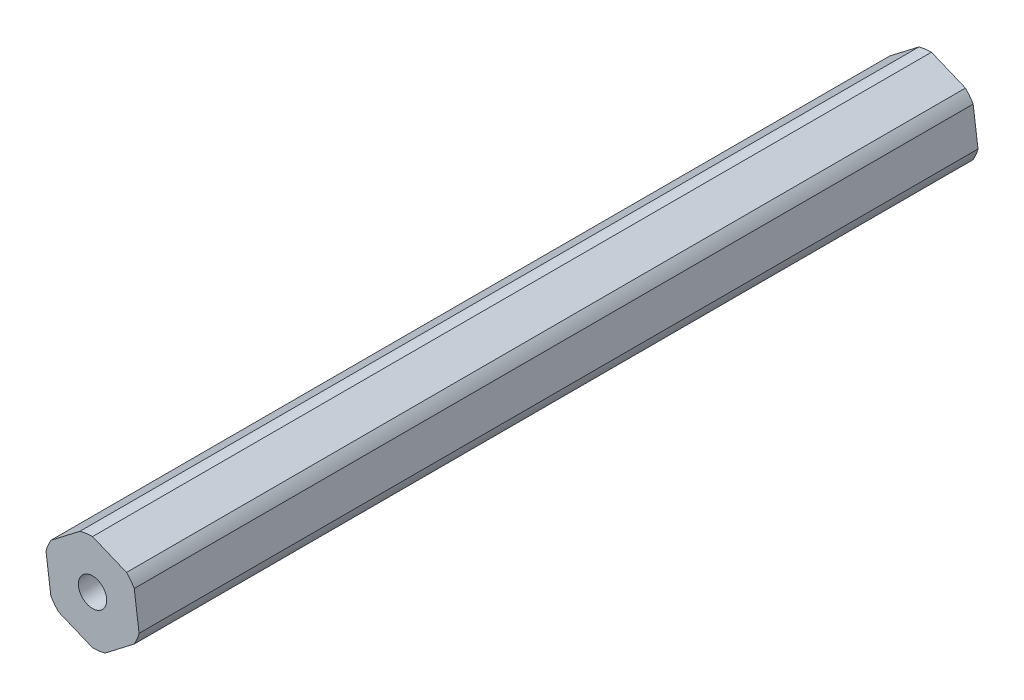
from build123d import *

# Parameters (mm, degrees)
BOSS_EXTRUDE1_DEPTH         = 119.6975
F_1_4_20_TAPPED_HOLE2_D     = 5.1054
F_1_4_20_TAPPED_HOLE2_DEPTH = 16.51
F_1_4_20_TAPPED_HOLE2_TIP   = 1.533816902
F_10_32_TAPPED_HOLE1_D      = 4.0386
F_10_32_TAPPED_HOLE1_DEPTH  = 13.6144
F_10_32_TAPPED_HOLE1_TIP    = 1.213317848


with BuildPart() as part:
    # Sketch1 → Boss-Extrude1 (new body)
    with BuildSketch(Plane.XY):
        with BuildLine():
            Line((-1.789892893, 6.63346078), (-5.950200742, 3.43535))
            ThreePointArc((-5.950200742, 3.43535), (-6.35, 2.623741315), (-6.639691997, 1.766637675))
            Line((-6.639691997, 1.766637675), (-5.950200742, -3.43535))
            ThreePointArc((-5.950200742, -3.43535), (-5.447226632, -4.187390656), (-4.849799104, -4.866823105))
            Line((-4.849799104, -4.866823105), (0, -6.8707))
            ThreePointArc((0, -6.8707), (0.902773368, -6.811131972), (1.789892893, -6.63346078))
            Line((1.789892893, -6.63346078), (5.950200742, -3.43535))
            ThreePointArc((5.950200742, -3.43535), (6.35, -2.623741315), (6.639691997, -1.766637675))
            Line((6.639691997, -1.766637675), (5.950200742, 3.43535))
            ThreePointArc((5.950200742, 3.43535), (5.447226632, 4.187390656), (4.849799104, 4.866823105))
            Line((4.849799104, 4.866823105), (0, 6.8707))
            ThreePointArc((0, 6.8707), (-0.902773368, 6.811131972), (-1.789892893, 6.63346078))
        make_face()
    extrude(amount=BOSS_EXTRUDE1_DEPTH)

    # 1/4-20 Tapped Hole2
    with Locations(Plane(origin=(0, 0, 0), x_dir=(-1, 0, 0), z_dir=(0, 0, -1))):
        with Locations((0, 0)):
            Hole(F_1_4_20_TAPPED_HOLE2_D / 2, depth=F_1_4_20_TAPPED_HOLE2_DEPTH)
            with Locations((0, 0, -(F_1_4_20_TAPPED_HOLE2_DEPTH + F_1_4_20_TAPPED_HOLE2_TIP / 2))):  # 118° drill point
                Cone(0, F_1_4_20_TAPPED_HOLE2_D / 2, F_1_4_20_TAPPED_HOLE2_TIP, mode=Mode.SUBTRACT)

    # #10-32 Tapped Hole1
    with Locations(Plane.XY.offset(119.6975)):
        with Locations((0, 0)):
            Hole(F_10_32_TAPPED_HOLE1_D / 2, depth=F_10_32_TAPPED_HOLE1_DEPTH)
            with Locations((0, 0, -(F_10_32_TAPPED_HOLE1_DEPTH + F_10_32_TAPPED_HOLE1_TIP / 2))):  # 118° drill point
                Cone(0, F_10_32_TAPPED_HOLE1_D / 2, F_10_32_TAPPED_HOLE1_TIP, mode=Mode.SUBTRACT)


solid = part.part
